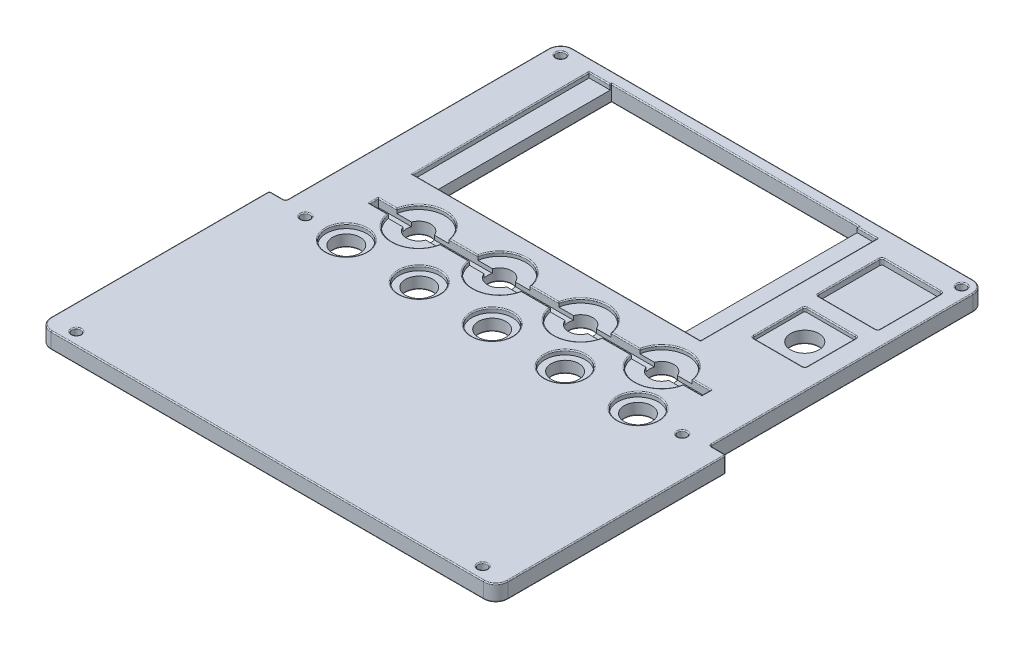
from build123d import *

# Parameters (mm, degrees)
MAIN_DEPTH                  = 4
DISPLAY_PCB_NOTCH_W         = 71
DISPLAY_PCB_NOTCH_H         = 43.5
PCB_NOTCH_DEPTH             = 1.2
DISPLAY_CUT_REACH           = 170.27
SKETCH4_W                   = 60.96
SKETCH4_H                   = 43.18
ROTARY_HOLE_REACH           = 170.27
SKETCH5_R                   = 3.5
MOUNTS_REACH                = 170.27
SKETCH6_R                   = 1.1
FILLET1_R                   = 3
TOGGLE_MOUNTS_REACH         = 170.27
SKETCH7_R                   = 3
SKETCH8_W                   = 82
SKETCH8_H                   = 2.1
TOGGLE_DIRECTION_DEPTH      = 2
SKETCH9_R                   = 6.5
TOGGLE_COUNTERSINKS_DEPTH   = 1
SKETCH10_W                  = 13
SKETCH10_H                  = 13
ENCODER_CLEARANCE_DEPTH     = 1
SKETCH11_W                  = 15
SKETCH11_H                  = 16
ENCODER_PIN_CLEARANCE_DEPTH = 1.5
FILLET2_R                   = 0.5
LED_MOUNTS_REACH            = 170.27
SKETCH12_R                  = 3.4
SKETCH13_R                  = 5
LED_COUNTERSINK_DEPTH       = 1.1
FILLET4_R                   = 0.25


with BuildPart() as part:
    # Sketch1 → Main (new body)
    with BuildSketch(Plane(origin=(0, 0, 0), x_dir=(1, 0, 0), z_dir=(0, 1, 0))):
        Polygon((112.8, 56.9), (108.8, 56.9), (108.8, 124.8), (4, 124.8), (4, 56.9), (0, 56.9), (0, 0), (112.8, 0), align=None)
    extrude(amount=MAIN_DEPTH)

    # Display PCB Notch → PCB Notch (cut)
    with BuildSketch(Plane.XZ.offset(-4)):
        with Locations((49.63, -99.97)):
            Rectangle(DISPLAY_PCB_NOTCH_W, DISPLAY_PCB_NOTCH_H)
    extrude(amount=PCB_NOTCH_DEPTH, mode=Mode.SUBTRACT)

    # Sketch4 → Display Cut (cut, up to next)
    with BuildSketch(Plane(origin=(0, 0, 0), x_dir=(-1, 0, 0), z_dir=(0, -1, 0)), mode=Mode.PRIVATE) as display_cut_sk1:
        with Locations((-49.81, 100.46)):
            Rectangle(SKETCH4_W, SKETCH4_H)
    display_cut_tool1 = extrude(display_cut_sk1.sketch, amount=-DISPLAY_CUT_REACH, mode=Mode.PRIVATE) & part.part
    add(display_cut_tool1.solids().sort_by_distance((49.81, 0, -100.46))[0], mode=Mode.SUBTRACT)

    # Sketch5 → Rotary Hole (cut, up to next)
    with BuildSketch(Plane.XZ, mode=Mode.PRIVATE) as rotary_hole_sk1:
        with Locations((97.32, -91.75)):
            Circle(SKETCH5_R)
    rotary_hole_tool1 = extrude(rotary_hole_sk1.sketch, amount=-ROTARY_HOLE_REACH, mode=Mode.PRIVATE) & part.part
    add(rotary_hole_tool1.solids().sort_by_distance((97.32, 0, -91.75))[0], mode=Mode.SUBTRACT)

    # Sketch6 → Mounts (cut, up to next)
    with BuildSketch(Plane.XZ, mode=Mode.PRIVATE) as mounts_sk1:
        with Locations((6.9, -121.9)):
            Circle(SKETCH6_R)
    mounts_tool1 = extrude(mounts_sk1.sketch, amount=-MOUNTS_REACH, mode=Mode.PRIVATE) & part.part
    # Sketch6 → Mounts (cut, up to next)
    with BuildSketch(Plane.XZ, mode=Mode.PRIVATE) as mounts_sk2:
        with Locations((9.9, -55.9)):
            Circle(SKETCH6_R)
    mounts_tool2 = extrude(mounts_sk2.sketch, amount=-MOUNTS_REACH, mode=Mode.PRIVATE) & part.part
    # Sketch6 → Mounts (cut, up to next)
    with BuildSketch(Plane.XZ, mode=Mode.PRIVATE) as mounts_sk3:
        with Locations((6.25, -3)):
            Circle(SKETCH6_R)
    mounts_tool3 = extrude(mounts_sk3.sketch, amount=-MOUNTS_REACH, mode=Mode.PRIVATE) & part.part
    # Sketch6 → Mounts (cut, up to next)
    with BuildSketch(Plane.XZ, mode=Mode.PRIVATE) as mounts_sk4:
        with Locations((105.9, -121.9)):
            Circle(SKETCH6_R)
    mounts_tool4 = extrude(mounts_sk4.sketch, amount=-MOUNTS_REACH, mode=Mode.PRIVATE) & part.part
    # Sketch6 → Mounts (cut, up to next)
    with BuildSketch(Plane.XZ, mode=Mode.PRIVATE) as mounts_sk5:
        with Locations((102.9, -55.9)):
            Circle(SKETCH6_R)
    mounts_tool5 = extrude(mounts_sk5.sketch, amount=-MOUNTS_REACH, mode=Mode.PRIVATE) & part.part
    # Sketch6 → Mounts (cut, up to next)
    with BuildSketch(Plane.XZ, mode=Mode.PRIVATE) as mounts_sk6:
        with Locations((106.55, -3)):
            Circle(SKETCH6_R)
    mounts_tool6 = extrude(mounts_sk6.sketch, amount=-MOUNTS_REACH, mode=Mode.PRIVATE) & part.part
    add(mounts_tool1.solids().sort_by_distance((6.9, 0, -121.9))[0], mode=Mode.SUBTRACT)
    add(mounts_tool2.solids().sort_by_distance((9.9, 0, -55.9))[0], mode=Mode.SUBTRACT)
    add(mounts_tool3.solids().sort_by_distance((6.25, 0, -3))[0], mode=Mode.SUBTRACT)
    add(mounts_tool4.solids().sort_by_distance((105.9, 0, -121.9))[0], mode=Mode.SUBTRACT)
    add(mounts_tool5.solids().sort_by_distance((102.9, 0, -55.9))[0], mode=Mode.SUBTRACT)
    add(mounts_tool6.solids().sort_by_distance((106.55, 0, -3))[0], mode=Mode.SUBTRACT)

    # Fillet1
    fillet1_edges = [part.edges().sort_by_distance(p)[0] for p in [
        (112.8, 2, 0),
        (108.8, 2, -124.8),
        (4, 2, -124.8),
        (0, 2, 0),
    ]]
    fillet(fillet1_edges, radius=FILLET1_R)

    # Sketch7 → Toggle Mounts (cut, up to next)
    with BuildSketch(Plane.XZ, mode=Mode.PRIVATE) as toggle_mounts_sk1:
        with Locations((26, -67.75)):
            Circle(SKETCH7_R)
    toggle_mounts_tool1 = extrude(toggle_mounts_sk1.sketch, amount=-TOGGLE_MOUNTS_REACH, mode=Mode.PRIVATE) & part.part
    # Sketch7 → Toggle Mounts (cut, up to next)
    with BuildSketch(Plane.XZ, mode=Mode.PRIVATE) as toggle_mounts_sk2:
        with Locations((46, -67.75)):
            Circle(SKETCH7_R)
    toggle_mounts_tool2 = extrude(toggle_mounts_sk2.sketch, amount=-TOGGLE_MOUNTS_REACH, mode=Mode.PRIVATE) & part.part
    # Sketch7 → Toggle Mounts (cut, up to next)
    with BuildSketch(Plane.XZ, mode=Mode.PRIVATE) as toggle_mounts_sk3:
        with Locations((66, -67.75)):
            Circle(SKETCH7_R)
    toggle_mounts_tool3 = extrude(toggle_mounts_sk3.sketch, amount=-TOGGLE_MOUNTS_REACH, mode=Mode.PRIVATE) & part.part
    # Sketch7 → Toggle Mounts (cut, up to next)
    with BuildSketch(Plane.XZ, mode=Mode.PRIVATE) as toggle_mounts_sk4:
        with Locations((86, -67.75)):
            Circle(SKETCH7_R)
    toggle_mounts_tool4 = extrude(toggle_mounts_sk4.sketch, amount=-TOGGLE_MOUNTS_REACH, mode=Mode.PRIVATE) & part.part
    add(toggle_mounts_tool1.solids().sort_by_distance((26, 0, -67.75))[0], mode=Mode.SUBTRACT)
    add(toggle_mounts_tool2.solids().sort_by_distance((46, 0, -67.75))[0], mode=Mode.SUBTRACT)
    add(toggle_mounts_tool3.solids().sort_by_distance((66, 0, -67.75))[0], mode=Mode.SUBTRACT)
    add(toggle_mounts_tool4.solids().sort_by_distance((86, 0, -67.75))[0], mode=Mode.SUBTRACT)

    # Sketch8 → Toggle Direction (cut)
    with BuildSketch(Plane.XZ.offset(-4)):
        with Locations((56, -67.75)):
            Rectangle(SKETCH8_W, SKETCH8_H)
    extrude(amount=TOGGLE_DIRECTION_DEPTH, mode=Mode.SUBTRACT)

    # Sketch9 → Toggle Countersinks (cut)
    with BuildSketch(Plane(origin=(0, 4, 0), x_dir=(1, 0, 0), z_dir=(0, 1, 0))):
        with Locations((26, 67.75)):
            Circle(SKETCH9_R)
        with Locations((46, 67.75)):
            Circle(SKETCH9_R)
        with Locations((66, 67.75)):
            Circle(SKETCH9_R)
        with Locations((86, 67.75)):
            Circle(SKETCH9_R)
    extrude(amount=-TOGGLE_COUNTERSINKS_DEPTH, mode=Mode.SUBTRACT)

    # Sketch10 → Encoder Clearance (cut)
    with BuildSketch(Plane(origin=(0, 4, 0), x_dir=(1, 0, 0), z_dir=(0, 1, 0))):
        with Locations((97.32, 91.75)):
            Rectangle(SKETCH10_W, SKETCH10_H)
    extrude(amount=-ENCODER_CLEARANCE_DEPTH, mode=Mode.SUBTRACT)

    # Sketch11 → Encoder Pin Clearance (cut)
    with BuildSketch(Plane(origin=(0, 4, 0), x_dir=(1, 0, 0), z_dir=(0, 1, 0))):
        with Locations((97.32, 110.25)):
            Rectangle(SKETCH11_W, SKETCH11_H)
    extrude(amount=-ENCODER_PIN_CLEARANCE_DEPTH, mode=Mode.SUBTRACT)

    # Fillet2
    fillet2_edges = [part.edges().sort_by_distance(p)[0] for p in [
        (0, 2, -56.9),
        (4, 2, -56.9),
        (112.8, 2, -56.9),
        (108.8, 2, -56.9),
        (89.82, 3.25, -102.25),
        (89.82, 3.25, -118.25),
        (104.82, 3.25, -118.25),
        (104.82, 3.25, -102.25),
        (103.82, 3.5, -85.25),
        (103.82, 3.5, -98.25),
        (90.82, 3.5, -98.25),
        (90.82, 3.5, -85.25),
    ]]
    fillet(fillet2_edges, radius=FILLET2_R)

    # Sketch12 → LED Mounts (cut, up to next)
    with BuildSketch(Plane(origin=(0, 4, 0), x_dir=(1, 0, 0), z_dir=(0, 1, 0)), mode=Mode.PRIVATE) as led_mounts_sk1:
        with Locations((20, 55.9)):
            Circle(SKETCH12_R)
    led_mounts_tool1 = extrude(led_mounts_sk1.sketch, amount=-LED_MOUNTS_REACH, mode=Mode.PRIVATE) & part.part
    # Sketch12 → LED Mounts (cut, up to next)
    with BuildSketch(Plane(origin=(0, 4, 0), x_dir=(1, 0, 0), z_dir=(0, 1, 0)), mode=Mode.PRIVATE) as led_mounts_sk2:
        with Locations((38, 55.9)):
            Circle(SKETCH12_R)
    led_mounts_tool2 = extrude(led_mounts_sk2.sketch, amount=-LED_MOUNTS_REACH, mode=Mode.PRIVATE) & part.part
    # Sketch12 → LED Mounts (cut, up to next)
    with BuildSketch(Plane(origin=(0, 4, 0), x_dir=(1, 0, 0), z_dir=(0, 1, 0)), mode=Mode.PRIVATE) as led_mounts_sk3:
        with Locations((56, 55.9)):
            Circle(SKETCH12_R)
    led_mounts_tool3 = extrude(led_mounts_sk3.sketch, amount=-LED_MOUNTS_REACH, mode=Mode.PRIVATE) & part.part
    # Sketch12 → LED Mounts (cut, up to next)
    with BuildSketch(Plane(origin=(0, 4, 0), x_dir=(1, 0, 0), z_dir=(0, 1, 0)), mode=Mode.PRIVATE) as led_mounts_sk4:
        with Locations((74, 55.9)):
            Circle(SKETCH12_R)
    led_mounts_tool4 = extrude(led_mounts_sk4.sketch, amount=-LED_MOUNTS_REACH, mode=Mode.PRIVATE) & part.part
    # Sketch12 → LED Mounts (cut, up to next)
    with BuildSketch(Plane(origin=(0, 4, 0), x_dir=(1, 0, 0), z_dir=(0, 1, 0)), mode=Mode.PRIVATE) as led_mounts_sk5:
        with Locations((92, 55.9)):
            Circle(SKETCH12_R)
    led_mounts_tool5 = extrude(led_mounts_sk5.sketch, amount=-LED_MOUNTS_REACH, mode=Mode.PRIVATE) & part.part
    add(led_mounts_tool1.solids().sort_by_distance((20, 4, -55.9))[0], mode=Mode.SUBTRACT)
    add(led_mounts_tool2.solids().sort_by_distance((38, 4, -55.9))[0], mode=Mode.SUBTRACT)
    add(led_mounts_tool3.solids().sort_by_distance((56, 4, -55.9))[0], mode=Mode.SUBTRACT)
    add(led_mounts_tool4.solids().sort_by_distance((74, 4, -55.9))[0], mode=Mode.SUBTRACT)
    add(led_mounts_tool5.solids().sort_by_distance((92, 4, -55.9))[0], mode=Mode.SUBTRACT)

    # Sketch13 → LED Countersink (cut)
    with BuildSketch(Plane(origin=(0, 4, 0), x_dir=(1, 0, 0), z_dir=(0, 1, 0))):
        with Locations((20, 55.9)):
            Circle(SKETCH13_R)
        with Locations((38, 55.9)):
            Circle(SKETCH13_R)
        with Locations((56, 55.9)):
            Circle(SKETCH13_R)
        with Locations((74, 55.9)):
            Circle(SKETCH13_R)
        with Locations((92, 55.9)):
            Circle(SKETCH13_R)
    extrude(amount=-LED_COUNTERSINK_DEPTH, mode=Mode.SUBTRACT)

    # Fillet4
    fillet4_edges = [part.edges().sort_by_distance(p)[0] for p in [
        (4, 4, -89.6),
        (4.878679656, 4, -123.921320344),
        (56.4, 4, -124.8),
        (111.921320344, 4, -0.878679656),
        (56.4, 4, 0),
        (4, 0, -89.6),
        (4.878679656, 0, -123.921320344),
        (56.4, 0, -124.8),
        (112.8, 0, -29.7),
        (111.921320344, 0, -0.878679656),
        (56.4, 0, 0),
        (108.946446609, 4, -57.046446609),
        (108.946446609, 0, -57.046446609),
        (3.853553391, 4, -57.046446609),
        (3.853553391, 0, -57.046446609),
        (90.966446609, 4, -85.396446609),
        (90.966446609, 4, -98.103553391),
        (103.673553391, 4, -98.103553391),
        (103.673553391, 4, -85.396446609),
        (104.673553391, 4, -102.396446609),
        (104.673553391, 4, -118.103553391),
        (89.966446609, 4, -118.103553391),
        (89.966446609, 4, -102.396446609),
        (0.146446609, 4, -56.753553391),
        (112.653553391, 4, -56.753553391),
        (0.146446609, 0, -56.753553391),
        (112.653553391, 0, -56.753553391),
        (107.921320344, 4, -123.921320344),
        (0.878679656, 4, -0.878679656),
        (107.921320344, 0, -123.921320344),
        (0.878679656, 0, -0.878679656),
        (2, 4, -56.9),
        (108.8, 4, -89.6),
        (110.8, 4, -56.9),
        (112.8, 4, -29.7),
        (0, 4, -29.7),
        (2, 0, -56.9),
        (108.8, 0, -89.6),
        (110.8, 0, -56.9),
        (0, 0, -29.7),
        (49.63, 4, -78.22),
        (85.13, 4, -99.97),
        (82.71, 4, -121.72),
        (16.73, 4, -121.72),
        (14.13, 4, -99.97),
        (49.81, 0, -78.87),
        (80.29, 0, -100.46),
        (49.81, 0, -122.05),
        (19.33, 0, -100.46),
        (93.82, 0, -91.75),
        (8.8, 4, -55.9),
        (8.8, 0, -55.9),
        (5.15, 4, -3),
        (5.15, 0, -3),
        (105.45, 0, -3),
        (105.45, 4, -3),
        (101.8, 0, -55.9),
        (101.8, 4, -55.9),
        (104.8, 0, -121.9),
        (104.8, 4, -121.9),
        (23, 0, -67.75),
        (43, 0, -67.75),
        (63, 0, -67.75),
        (83, 0, -67.75),
        (17.292684144, 4, -68.8),
        (36, 4, -68.8),
        (56, 4, -68.8),
        (76, 4, -68.8),
        (94.707315856, 4, -68.8),
        (15, 4, -67.75),
        (94.707315856, 4, -66.7),
        (76, 4, -66.7),
        (56, 4, -66.7),
        (36, 4, -66.7),
        (17.292684144, 4, -66.7),
        (97, 4, -67.75),
        (26, 4, -74.25),
        (26, 4, -61.25),
        (46, 4, -74.25),
        (46, 4, -61.25),
        (66, 4, -74.25),
        (66, 4, -61.25),
        (86, 4, -74.25),
        (86, 4, -61.25),
        (97.32, 4, -85.25),
        (90.82, 4, -91.75),
        (97.32, 4, -98.25),
        (103.82, 4, -91.75),
        (97.32, 4, -118.25),
        (104.82, 4, -110.25),
        (97.32, 4, -102.25),
        (89.82, 4, -110.25),
        (88.6, 0, -55.9),
        (16.6, 0, -55.9),
        (34.6, 0, -55.9),
        (52.6, 0, -55.9),
        (70.6, 0, -55.9),
        (15, 4, -55.9),
        (33, 4, -55.9),
        (51, 4, -55.9),
        (69, 4, -55.9),
        (87, 4, -55.9),
        (5.8, 4, -121.9),
        (80.29, 4, -121.885),
        (49.81, 4, -122.05),
        (19.33, 4, -121.885),
        (5.8, 0, -121.9),
    ]]
    fillet(fillet4_edges, radius=FILLET4_R)


solid = part.part
